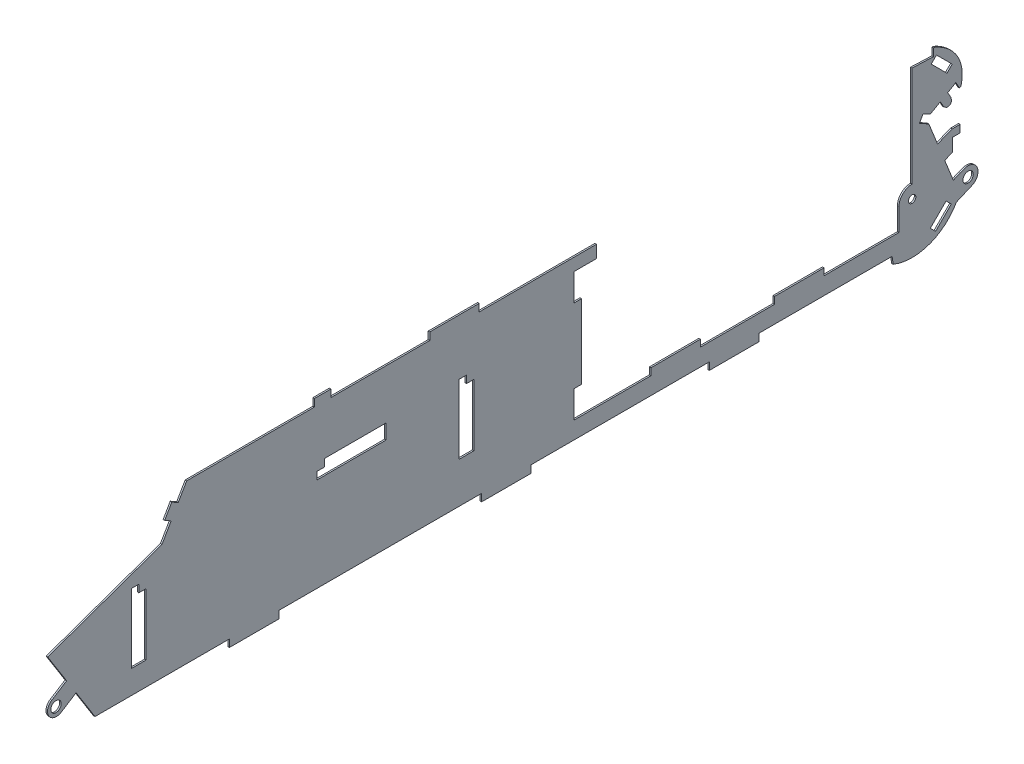
from build123d import *

# Parameters (mm, degrees)
BOSS_EXTRUDE1_DEPTH = 3


with BuildPart() as part:
    # Sketch1 → Boss-Extrude1 (new body)
    with BuildSketch(Plane(origin=(0, 0, 0), x_dir=(0, 0, -1), z_dir=(1, 0, 0))):
        with BuildLine():
            add(Edge.make_bspline(
                [(891.480987705, -67.383705479), (889.221636004, -67.383705479), (887.048990051, -67.775548763), (885.036416249, -68.487536347)],
                knots=[0, 0, 0, 0, 1, 1, 1, 1], degree=3))
            Line((885.036416249, -68.487536347), (876.035692647, -71.880732443))
            Line((876.035692647, -71.880732443), (862.592966883, -77.441572238))
            Line((862.592966883, -77.441572238), (845.713692149, -35.430969953))
            Line((845.713692149, -35.430969953), (859.219779806, -30.008525871))
            Line((859.219779806, -30.008525871), (861.23068619, -29.136466137))
            Line((861.23068619, -29.136466137), (861.28737841, -3.915098002))
            Line((861.28737841, -3.915098002), (875.80725635, -3.915098002))
            Line((875.80725635, -3.915098002), (875.80725635, 10.604779938))
            Line((875.80725635, 10.604779938), (861.28737841, 10.604779938))
            Line((861.28737841, 10.604779938), (860.233570089, 10.604779938))
            Line((860.233570089, 10.604779938), (831.79575219, -0.777016895))
            Line((831.79575219, -0.777016895), (814.633016357, 41.940570719))
            Line((814.633016357, 41.940570719), (796.366449655, 51.963421695))
            Line((796.366449655, 51.963421695), (803.352932036, 64.692492457))
            Line((803.352932036, 64.692492457), (817.399263199, 56.989020238))
            Line((817.399263199, 56.989020238), (837.13482536, 68.197405575))
            Line((837.13482536, 68.197405575), (844.349744038, 55.54670347))
            Line((844.349744038, 55.54670347), (845.340190466, 56.108623413))
            add(Edge.make_bspline(
                [(845.340190466, 56.108623413), (846.577414792, 53.86094364), (848.931809331, 52.30690985), (851.68304941, 52.30690985)],
                knots=[19, 19, 19, 19, 20, 20, 20, 20], degree=3))
            add(Edge.make_bspline(
                [(851.68304941, 52.30690985), (855.698192506, 52.30690985), (858.94298838, 55.558375397), (858.94298838, 59.566848821)],
                knots=[20, 20, 20, 20, 21, 21, 21, 21], degree=3))
            add(Edge.make_bspline(
                [(858.94298838, 59.566848821), (858.94298838, 60.922459841), (858.551145096, 62.178025767), (857.905854241, 63.263515035)],
                knots=[21, 21, 21, 21, 22, 22, 22, 22], degree=3))
            Line((857.905854241, 63.263515035), (858.752902702, 63.747066321))
            Line((858.752902702, 63.747066321), (851.542986278, 76.376091989))
            Line((851.542986278, 76.376091989), (864.597203595, 83.799437946))
            Line((864.597203595, 83.799437946), (867.335104327, 85.730308255))
            Line((867.335104327, 85.730308255), (874.595043297, 72.776136032))
            Line((874.595043297, 72.776136032), (877.541371308, 74.446889098))
            add(Edge.make_bspline(
                [(877.541371308, 74.446889098), (889.066566109, 122.041675033), (856.198417974, 153.629245967), (826.745142374, 165.794729367)],
                knots=[28, 28, 28, 28, 29, 29, 29, 29], degree=3))
            Line((826.745142374, 165.794729367), (824.050594515, 165.919785735))
            Line((824.050594515, 165.919785735), (823.483672317, 151.408244886))
            Line((823.483672317, 151.408244886), (823.403636242, 151.393238122))
            Line((823.403636242, 151.393238122), (781.921605536, 153.008966386))
            Line((781.921605536, 153.008966386), (781.921605536, -43.571305748))
            add(Edge.make_bspline(
                [(781.921605536, -43.571305748), (767.698528041, -43.571305748), (756.169998404, -55.103170221), (756.169998404, -69.32291288)],
                knots=[34, 34, 34, 34, 35, 35, 35, 35], degree=3))
            Line((756.169998404, -69.32291288), (756.169998404, -112.850865753))
            Line((756.169998404, -112.850865753), (609.640619257, -112.829189316))
            Line((609.640619257, -112.829189316), (609.640619257, -99.343110678))
            Line((609.640619257, -99.343110678), (512.848658469, -99.343110678))
            Line((512.848658469, -99.343110678), (512.848658469, -112.829189316))
            Line((512.848658469, -112.829189316), (367.646544232, -112.829189316))
            Line((367.646544232, -112.829189316), (367.646544232, -99.346445515))
            Line((367.646544232, -99.346445515), (270.84958119, -99.346445515))
            Line((270.84958119, -99.346445515), (270.84958119, -112.830856735))
            Line((270.84958119, -112.830856735), (120.795279906, -112.830856735))
            Line((120.795279906, -112.830856735), (120.795279906, -59.590192676))
            Line((120.795279906, -59.590192676), (135.308488174, -59.590192676))
            Line((135.308488174, -59.590192676), (135.308488174, 85.606919306))
            Line((135.308488174, 85.606919306), (120.786942815, 85.606919306))
            Line((120.786942815, 85.606919306), (120.786942815, 138.85258562))
            Line((120.786942815, 138.85258562), (164.074787464, 138.85258562))
            Line((164.074787464, 138.85258562), (164.268207979, 163.213565949))
            Line((164.268207979, 163.213565949), (-64.993461447, 163.213565949))
            Line((-64.993461447, 163.213565949), (-64.993461447, 177.733443889))
            Line((-64.993461447, 177.733443889), (-161.792091908, 177.733443889))
            Line((-161.792091908, 177.733443889), (-161.792091908, 163.213565949))
            Line((-161.792091908, 163.213565949), (-355.391020248, 163.213565949))
            Line((-355.391020248, 163.213565949), (-355.391020248, 177.733443889))
            Line((-355.391020248, 177.733443889), (-387.43212894, 177.733443889))
            Line((-387.43212894, 177.733443889), (-387.43212894, 163.213565949))
            Line((-387.43212894, 163.213565949), (-637.371451827, 163.213565949))
            Line((-637.371451827, 163.213565949), (-653.973935135, 134.515630806))
            Line((-653.973935135, 134.515630806), (-666.53959891, 141.79057654))
            Line((-666.53959891, 141.79057654), (-680.412518578, 117.81643724))
            Line((-680.412518578, 117.81643724), (-667.846854802, 110.536489251))
            Line((-667.846854802, 110.536489251), (-685.703236619, 79.679247501))
            Line((-685.703236619, 79.679247501), (-909.342371776, 0.683641474))
            Line((-909.342371776, 0.683641474), (-872.325687087, -58.204568127))
            Line((-872.325687087, -58.204568127), (-901.397123914, -76.567845086))
            add(Edge.make_bspline(
                [(-901.397123914, -76.567845086), (-909.587482256, -81.660140358), (-912.095279272, -92.434996955), (-906.999649164, -100.625355297)],
                knots=[69, 69, 69, 69, 70, 70, 70, 70], degree=3))
            add(Edge.make_bspline(
                [(-906.999649164, -100.625355297), (-901.904019055, -108.815713639), (-891.134164713, -111.325178074), (-882.943806371, -106.222878292)],
                knots=[70, 70, 70, 70, 71, 71, 71, 71], degree=3))
            Line((-882.943806371, -106.222878292), (-853.768989614, -87.724540457))
            Line((-853.768989614, -87.724540457), (-816.798992636, -146.541051075))
            Line((-816.798992636, -146.541051075), (-553.782108578, -146.541051075))
            Line((-553.782108578, -146.541051075), (-553.782108578, -161.020910977))
            Line((-553.782108578, -161.020910977), (-456.981810699, -161.020910977))
            Line((-456.981810699, -161.020910977), (-456.981810699, -146.541051075))
            Line((-456.981810699, -146.541051075), (-60.099588945, -146.541051075))
            Line((-60.099588945, -146.541051075), (-60.099588945, -161.020910977))
            Line((-60.099588945, -161.020910977), (36.697374098, -161.020910977))
            Line((36.697374098, -161.020910977), (36.697374098, -146.541051075))
            Line((36.697374098, -146.541051075), (385.176112076, -146.541051075))
            Line((385.176112076, -146.541051075), (385.176112076, -161.059261596))
            Line((385.176112076, -161.059261596), (481.974742537, -161.059261596))
            Line((481.974742537, -161.059261596), (481.974742537, -146.541051075))
            Line((481.974742537, -146.541051075), (742.743946822, -146.541051075))
            Line((742.743946822, -146.541051075), (744.906588265, -161.059261596))
            add(Edge.make_bspline(
                [(744.906588265, -161.059261596), (756.393432446, -165.704688783), (768.919078184, -168.282517365), (782.063336085, -168.282517365)],
                knots=[87, 87, 87, 87, 88, 88, 88, 88], degree=3))
            add(Edge.make_bspline(
                [(782.063336085, -168.282517365), (819.203409723, -168.282517365), (851.561327879, -147.86331373), (868.542315125, -117.643025744)],
                knots=[88, 88, 88, 88, 89, 89, 89, 89], degree=3))
            Line((868.542315125, -117.643025744), (898.745928929, -104.700525449))
            add(Edge.make_bspline(
                [(898.745928929, -104.700525449), (905.839126076, -101.820894167), (910.838045928, -94.872762406), (910.841380764, -86.749100793)],
                knots=[90, 90, 90, 90, 91, 91, 91, 91], degree=3))
            add(Edge.make_bspline(
                [(910.841380764, -86.749100793), (910.838045928, -76.047610598), (902.17247339, -67.383705479), (891.480987705, -67.383705479)],
                knots=[91, 91, 91, 91, 92, 92, 92, 92], degree=3))
        make_face()
        with BuildLine():
            add(Edge.make_bspline(
                [(-893.018347312, -101.729186164), (-898.617537726, -101.729186164), (-903.157917564, -97.197143417), (-903.157917564, -91.591283331), (-903.157917564, -85.993760335), (-898.619205144, -81.451713079), (-893.018347312, -81.451713079)],
                knots=[0, 0, 0, 0, 1, 1, 1, 2, 2, 2, 2], degree=3))
            add(Edge.make_bspline(
                [(-893.018347312, -81.451713079), (-887.41748948, -81.451713079), (-882.880444478, -85.990425499), (-882.880444478, -91.591283331), (-882.880444478, -97.197143417), (-887.419156898, -101.729186164), (-893.018347312, -101.729186164)],
                knots=[2, 2, 2, 2, 3, 3, 3, 4, 4, 4, 4], degree=3))
        make_face(mode=Mode.SUBTRACT)
        Polygon((-716.552141278, 20.284142758), (-716.550473859, -100.715395881), (-745.590229739, -100.715395881), (-745.590229739, 34.804020698), (-731.070351799, 34.804020698), (-731.070351799, 20.284142758), align=None, mode=Mode.SUBTRACT)
        Polygon((-75.253085812, 54.16274634), (-75.253085812, -66.835124882), (-104.291174274, -66.835124882), (-104.291174274, 68.68262428), (-89.771296334, 68.68262428), (-89.771296334, 54.16274634), align=None, mode=Mode.SUBTRACT)
        Polygon((858.632848589, -115.813867947), (827.832299059, -146.616084895), (817.562670185, -136.349790858), (848.366554552, -105.547573909), align=None, mode=Mode.SUBTRACT)
        with BuildLine():
            add(Edge.make_bspline(
                [(891.480987705, -96.85532268), (885.896804055, -96.85532268), (881.373098399, -92.331617025), (881.373098399, -86.750768211), (881.373098399, -81.164917144), (885.8918018, -76.641211488), (891.480987705, -76.641211488)],
                knots=[0, 0, 0, 0, 1, 1, 1, 2, 2, 2, 2], degree=3))
            add(Edge.make_bspline(
                [(891.480987705, -76.641211488), (897.065171354, -76.641211488), (901.590544428, -81.159914889), (901.590544428, -86.750768211), (901.590544428, -92.331617025), (897.0601691, -96.85532268), (891.480987705, -96.85532268)],
                knots=[2, 2, 2, 2, 3, 3, 3, 4, 4, 4, 4], degree=3))
        make_face(mode=Mode.SUBTRACT)
        with BuildLine():
            add(Edge.make_bspline(
                [(782.054998994, -76.357750389), (778.043190735, -76.357750389), (774.795060024, -73.10795226), (774.795060024, -69.097811419)],
                knots=[2, 2, 2, 2, 3, 3, 3, 3], degree=3))
            Line((774.795060024, -69.097811419), (774.795060024, -69.094476582))
            add(Edge.make_bspline(
                [(774.795060024, -69.094476582), (774.795060024, -65.079333486), (778.043190735, -61.834537612), (782.054998994, -61.834537612)],
                knots=[5, 5, 5, 5, 6, 6, 6, 6], degree=3))
            add(Edge.make_bspline(
                [(782.054998994, -61.834537612), (786.062916828, -61.834537612), (789.314036619, -65.083434935), (789.314937777, -69.092809164)],
                knots=[6, 6, 6, 6, 6.999861396, 6.999861396, 6.999861396, 6.999861396], degree=3))
            add(Edge.make_bspline(
                [(789.314937777, -69.092809164), (789.314937902, -69.093364956), (789.314937964, -69.093920762), (789.314937964, -69.094476582)],
                knots=[6.999861396, 6.999861396, 6.999861396, 6.999861396, 7, 7, 7, 7], degree=3))
            add(Edge.make_bspline(
                [(789.314937964, -69.094476582), (789.314937964, -73.10795226), (786.065139835, -76.357750389), (782.054998994, -76.357750389)],
                knots=[1, 1, 1, 1, 2, 2, 2, 2], degree=3))
        make_face(mode=Mode.SUBTRACT)
        Polygon((-247.070529823, 66.261533011), (-247.070529823, 37.223444549), (-382.588278984, 37.223444549), (-382.588278984, 51.743322489), (-368.068401044, 51.743322489), (-368.068401044, 66.261533011), align=None, mode=Mode.SUBTRACT)
        Polygon((819.358479618, 140.888503278), (829.628108492, 151.158132151), (860.428658022, 120.354247785), (850.162363985, 110.086286329), align=None, mode=Mode.SUBTRACT)
    extrude(amount=BOSS_EXTRUDE1_DEPTH)


solid = part.part
